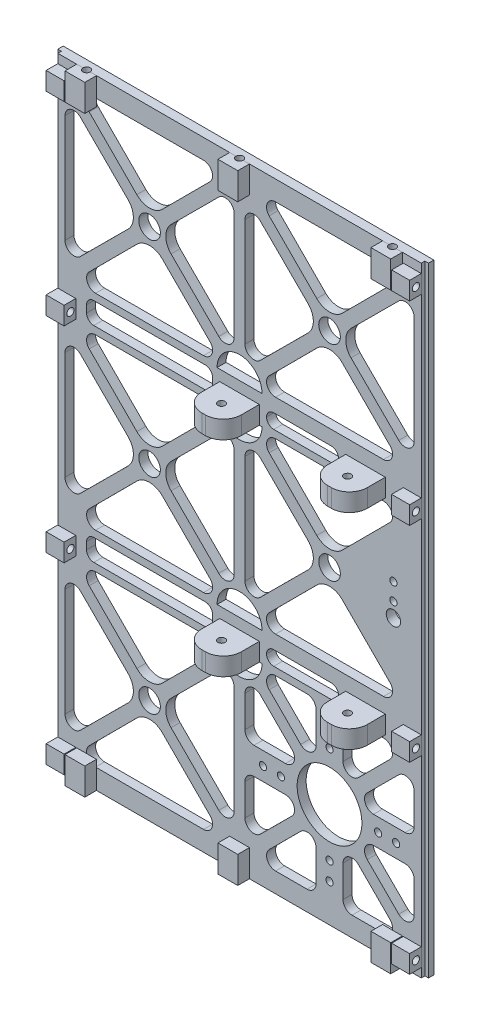
from build123d import *

# Parameters (mm, degrees)
SKICA1_W                  = 206
SKICA1_H                  = 344
P_IDAT_VYSUNUT_M1_DEPTH   = 5
SKICA3_R                  = 6
ODEBRAT_VYSUNUT_M2_DEPTH  = 10
SKICA21_W                 = 2
SKICA21_H                 = 2
ODEBRAT_VYSUNUT_M11_DEPTH = 360.123934039
SKICA16_W                 = 6.5
SKICA16_H                 = 10
P_IDAT_VYSUNUT_M5_DEPTH   = 10
P_IDAT_VYSUNUT_M5_2_DEPTH = 10
P_IDAT_VYSUNUT_M5_3_DEPTH = 10
P_IDAT_VYSUNUT_M5_4_DEPTH = 10
LINPOLE2_COUNT            = 2
LINPOLE2_PITCH            = 192
P_IDAT_VYSUNUT_M2_DEPTH   = 20
SKICA19_R                 = 2
ODEBRAT_VYSUNUT_M10_DEPTH = 269.001865665
P_IDAT_VYSUNUT_M3_DEPTH   = 5
SKICA9_R                  = 4
SKICA9_R_2                = 2
ODEBRAT_VYSUNUT_M6_DEPTH  = 203.034650493
SKICA11_R                 = 3
ODEBRAT_VYSUNUT_M7_DEPTH  = 2
LINPOLE3_COUNT            = 2
LINPOLE3_PITCH            = 114
SKICA12_W                 = 38
SKICA12_H                 = 15
SKICA12_R                 = 2
SKICA12_W_2               = 15
SKICA12_H_2               = 38
P_IDAT_VYSUNUT_M4_DEPTH   = 5
SKICA6_R                  = 2
SKICA6_R_2                = 6
ODEBRAT_VYSUNUT_M8_DEPTH  = 255.155464234
ZAOBLIT1_R                = 5
SKICA22_R                 = 2
ODEBRAT_VYSUNUT_M12_DEPTH = 269.001865665
P_IDAT_VYSUNUT_M9_DEPTH   = 6.5
P_IDAT_VYSUNUT_M9_2_DEPTH = 6.5
P_IDAT_VYSUNUT_M9_3_DEPTH = 6.5
SKICA24_R                 = 2
ODEBRAT_VYSUNUT_M13_DEPTH = 12
SKICA25_W                 = 48
SKICA25_H                 = 20
SKICA25_W_2               = 10
ODEBRAT_VYSUNUT_M14_DEPTH = 130
LINPOLE4_COUNT            = 2
LINPOLE4_PITCH            = 329
ZAOBLIT2_R                = 10
SKICA26_R                 = 18
SKICA26_W                 = 70
SKICA26_H                 = 12
SKICA26_W_2               = 40
SKICA26_H_2               = 8
ODEBRAT_VYSUNUT_M15_DEPTH = 202.477045839
ZAOBLIT3_R                = 4
SKICA28_R                 = 2
ODEBRAT_VYSUNUT_M16_DEPTH = 10
LINPOLE5_COUNT            = 2
LINPOLE5_PITCH            = 192


with BuildPart() as part:
    # Skica1 → Přidat vysunutím1 (new body)
    with BuildSketch(Plane.XY):
        Rectangle(SKICA1_W, SKICA1_H)
    extrude(amount=P_IDAT_VYSUNUT_M1_DEPTH)

    # Skica3 → Odebrat vysunutím2 (cut)
    with BuildSketch(Plane.XY.offset(5)):
        with Locations((50, 0)):
            Circle(SKICA3_R)
        with Locations((50, -114)):
            Circle(SKICA3_R)
        with Locations((50, 114)):
            Circle(SKICA3_R)
        with Locations((-50, -114)):
            Circle(SKICA3_R)
        with Locations((-50, 0)):
            Circle(SKICA3_R)
        with Locations((-50, 114)):
            Circle(SKICA3_R)
        with BuildLine():
            Line((11.530789502, 33.540271952), (38.061579004, 7.080543903))
            ThreePointArc((38.061579004, 7.080543903), (41, 0), (38.061579004, -7.080543903))
            Line((38.061579004, -7.080543903), (11.530789502, -33.540271952))
            ThreePointArc((11.530789502, -33.540271952), (6.083485913, -34.618113658), (3, -30))
            Line((3, -30), (3, 30))
            ThreePointArc((3, 30), (6.083485913, 34.618113658), (11.530789502, 33.540271952))
        make_face()
        with BuildLine():
            Line((83.540271952, 38.469210498), (57.080543903, 11.938420996))
            ThreePointArc((57.080543903, 11.938420996), (50, 9), (42.919456097, 11.938420996))
            Line((42.919456097, 11.938420996), (16.459728048, 38.469210498))
            ThreePointArc((16.459728048, 38.469210498), (15.381886342, 43.916514087), (20, 47))
            Line((20, 47), (80, 47))
            ThreePointArc((80, 47), (84.618113658, 43.916514087), (83.540271952, 38.469210498))
        make_face()
        with BuildLine():
            Line((16.459728048, -38.469210498), (42.919456097, -11.938420996))
            ThreePointArc((42.919456097, -11.938420996), (50, -9), (57.080543903, -11.938420996))
            Line((57.080543903, -11.938420996), (83.540271952, -38.469210498))
            ThreePointArc((83.540271952, -38.469210498), (84.618113658, -43.916514087), (80, -47))
            Line((80, -47), (20, -47))
            ThreePointArc((20, -47), (15.381886342, -43.916514087), (16.459728048, -38.469210498))
        make_face()
        with BuildLine():
            Line((97, 30), (97, -30))
            ThreePointArc((97, -30), (93.916514087, -34.618113658), (88.469210498, -33.540271952))
            Line((88.469210498, -33.540271952), (61.938420996, -7.080543903))
            ThreePointArc((61.938420996, -7.080543903), (59, 0), (61.938420996, 7.080543903))
            Line((61.938420996, 7.080543903), (88.469210498, 33.540271952))
            ThreePointArc((88.469210498, 33.540271952), (93.916514087, 34.618113658), (97, 30))
        make_face()
        with BuildLine():
            Line((16.459728048, -152.469210498), (42.919456097, -125.938420996))
            ThreePointArc((42.919456097, -125.938420996), (50, -123), (57.080543903, -125.938420996))
            Line((57.080543903, -125.938420996), (83.540271952, -152.469210498))
            ThreePointArc((83.540271952, -152.469210498), (84.618113658, -157.916514087), (80, -161))
            Line((80, -161), (20, -161))
            ThreePointArc((20, -161), (15.381886342, -157.916514087), (16.459728048, -152.469210498))
        make_face()
        with BuildLine():
            Line((88.469210498, -147.540271952), (61.938420996, -121.080543903))
            ThreePointArc((61.938420996, -121.080543903), (59, -114), (61.938420996, -106.919456097))
            Line((61.938420996, -106.919456097), (88.469210498, -80.459728048))
            ThreePointArc((88.469210498, -80.459728048), (93.916514087, -79.381886342), (97, -84))
            Line((97, -84), (97, -144))
            ThreePointArc((97, -144), (93.916514087, -148.618113658), (88.469210498, -147.540271952))
        make_face()
        with BuildLine():
            Line((20, -67), (80, -67))
            ThreePointArc((80, -67), (84.618113658, -70.083485913), (83.540271952, -75.530789502))
            Line((83.540271952, -75.530789502), (57.080543903, -102.061579004))
            ThreePointArc((57.080543903, -102.061579004), (50, -105), (42.919456097, -102.061579004))
            Line((42.919456097, -102.061579004), (16.459728048, -75.530789502))
            ThreePointArc((16.459728048, -75.530789502), (15.381886342, -70.083485913), (20, -67))
        make_face()
        with BuildLine():
            Line((3, -144), (3, -84))
            ThreePointArc((3, -84), (6.083485913, -79.381886342), (11.530789502, -80.459728048))
            Line((11.530789502, -80.459728048), (38.061579004, -106.919456097))
            ThreePointArc((38.061579004, -106.919456097), (41, -114), (38.061579004, -121.080543903))
            Line((38.061579004, -121.080543903), (11.530789502, -147.540271952))
            ThreePointArc((11.530789502, -147.540271952), (6.083485913, -148.618113658), (3, -144))
        make_face()
        with BuildLine():
            Line((20, 161), (80, 161))
            ThreePointArc((80, 161), (84.618113658, 157.916514087), (83.540271952, 152.469210498))
            Line((83.540271952, 152.469210498), (57.080543903, 125.938420996))
            ThreePointArc((57.080543903, 125.938420996), (50, 123), (42.919456097, 125.938420996))
            Line((42.919456097, 125.938420996), (16.459728048, 152.469210498))
            ThreePointArc((16.459728048, 152.469210498), (15.381886342, 157.916514087), (20, 161))
        make_face()
        with BuildLine():
            Line((3, 84), (3, 144))
            ThreePointArc((3, 144), (6.083485913, 148.618113658), (11.530789502, 147.540271952))
            Line((11.530789502, 147.540271952), (38.061579004, 121.080543903))
            ThreePointArc((38.061579004, 121.080543903), (41, 114), (38.061579004, 106.919456097))
            Line((38.061579004, 106.919456097), (11.530789502, 80.459728048))
            ThreePointArc((11.530789502, 80.459728048), (6.083485913, 79.381886342), (3, 84))
        make_face()
        with BuildLine():
            Line((16.459728048, 75.530789502), (42.919456097, 102.061579004))
            ThreePointArc((42.919456097, 102.061579004), (50, 105), (57.080543903, 102.061579004))
            Line((57.080543903, 102.061579004), (83.540271952, 75.530789502))
            ThreePointArc((83.540271952, 75.530789502), (84.618113658, 70.083485913), (80, 67))
            Line((80, 67), (20, 67))
            ThreePointArc((20, 67), (15.381886342, 70.083485913), (16.459728048, 75.530789502))
        make_face()
        with BuildLine():
            Line((88.469210498, 80.459728048), (61.938420996, 106.919456097))
            ThreePointArc((61.938420996, 106.919456097), (59, 114), (61.938420996, 121.080543903))
            Line((61.938420996, 121.080543903), (88.469210498, 147.540271952))
            ThreePointArc((88.469210498, 147.540271952), (93.916514087, 148.618113658), (97, 144))
            Line((97, 144), (97, 84))
            ThreePointArc((97, 84), (93.916514087, 79.381886342), (88.469210498, 80.459728048))
        make_face()
        with BuildLine():
            Line((-20, -161), (-80, -161))
            ThreePointArc((-80, -161), (-84.618113658, -157.916514087), (-83.540271952, -152.469210498))
            Line((-83.540271952, -152.469210498), (-57.080543903, -125.938420996))
            ThreePointArc((-57.080543903, -125.938420996), (-50, -123), (-42.919456097, -125.938420996))
            Line((-42.919456097, -125.938420996), (-16.459728048, -152.469210498))
            ThreePointArc((-16.459728048, -152.469210498), (-15.381886342, -157.916514087), (-20, -161))
        make_face()
        with BuildLine():
            Line((-97, -144), (-97, -84))
            ThreePointArc((-97, -84), (-93.916514087, -79.381886342), (-88.469210498, -80.459728048))
            Line((-88.469210498, -80.459728048), (-61.938420996, -106.919456097))
            ThreePointArc((-61.938420996, -106.919456097), (-59, -114), (-61.938420996, -121.080543903))
            Line((-61.938420996, -121.080543903), (-88.469210498, -147.540271952))
            ThreePointArc((-88.469210498, -147.540271952), (-93.916514087, -148.618113658), (-97, -144))
        make_face()
        with BuildLine():
            Line((-16.459728048, -75.530789502), (-42.919456097, -102.061579004))
            ThreePointArc((-42.919456097, -102.061579004), (-50, -105), (-57.080543903, -102.061579004))
            Line((-57.080543903, -102.061579004), (-83.540271952, -75.530789502))
            ThreePointArc((-83.540271952, -75.530789502), (-84.618113658, -70.083485913), (-80, -67))
            Line((-80, -67), (-20, -67))
            ThreePointArc((-20, -67), (-15.381886342, -70.083485913), (-16.459728048, -75.530789502))
        make_face()
        with BuildLine():
            Line((-11.530789502, -147.540271952), (-38.061579004, -121.080543903))
            ThreePointArc((-38.061579004, -121.080543903), (-41, -114), (-38.061579004, -106.919456097))
            Line((-38.061579004, -106.919456097), (-11.530789502, -80.459728048))
            ThreePointArc((-11.530789502, -80.459728048), (-6.083485913, -79.381886342), (-3, -84))
            Line((-3, -84), (-3, -144))
            ThreePointArc((-3, -144), (-6.083485913, -148.618113658), (-11.530789502, -147.540271952))
        make_face()
        with BuildLine():
            Line((-20, -47), (-80, -47))
            ThreePointArc((-80, -47), (-84.618113658, -43.916514087), (-83.540271952, -38.469210498))
            Line((-83.540271952, -38.469210498), (-57.080543903, -11.938420996))
            ThreePointArc((-57.080543903, -11.938420996), (-50, -9), (-42.919456097, -11.938420996))
            Line((-42.919456097, -11.938420996), (-16.459728048, -38.469210498))
            ThreePointArc((-16.459728048, -38.469210498), (-15.381886342, -43.916514087), (-20, -47))
        make_face()
        with BuildLine():
            Line((-88.469210498, 33.540271952), (-61.938420996, 7.080543903))
            ThreePointArc((-61.938420996, 7.080543903), (-59, 0), (-61.938420996, -7.080543903))
            Line((-61.938420996, -7.080543903), (-88.469210498, -33.540271952))
            ThreePointArc((-88.469210498, -33.540271952), (-93.916514087, -34.618113658), (-97, -30))
            Line((-97, -30), (-97, 30))
            ThreePointArc((-97, 30), (-93.916514087, 34.618113658), (-88.469210498, 33.540271952))
        make_face()
        with BuildLine():
            Line((-3, 30), (-3, -30))
            ThreePointArc((-3, -30), (-6.083485913, -34.618113658), (-11.530789502, -33.540271952))
            Line((-11.530789502, -33.540271952), (-38.061579004, -7.080543903))
            ThreePointArc((-38.061579004, -7.080543903), (-41, 0), (-38.061579004, 7.080543903))
            Line((-38.061579004, 7.080543903), (-11.530789502, 33.540271952))
            ThreePointArc((-11.530789502, 33.540271952), (-6.083485913, 34.618113658), (-3, 30))
        make_face()
        with BuildLine():
            Line((-16.459728048, 38.469210498), (-42.919456097, 11.938420996))
            ThreePointArc((-42.919456097, 11.938420996), (-50, 9), (-57.080543903, 11.938420996))
            Line((-57.080543903, 11.938420996), (-83.540271952, 38.469210498))
            ThreePointArc((-83.540271952, 38.469210498), (-84.618113658, 43.916514087), (-80, 47))
            Line((-80, 47), (-20, 47))
            ThreePointArc((-20, 47), (-15.381886342, 43.916514087), (-16.459728048, 38.469210498))
        make_face()
        with BuildLine():
            Line((-20, 67), (-80, 67))
            ThreePointArc((-80, 67), (-84.618113658, 70.083485913), (-83.540271952, 75.530789502))
            Line((-83.540271952, 75.530789502), (-57.080543903, 102.061579004))
            ThreePointArc((-57.080543903, 102.061579004), (-50, 105), (-42.919456097, 102.061579004))
            Line((-42.919456097, 102.061579004), (-16.459728048, 75.530789502))
            ThreePointArc((-16.459728048, 75.530789502), (-15.381886342, 70.083485913), (-20, 67))
        make_face()
        with BuildLine():
            Line((-97, 84), (-97, 144))
            ThreePointArc((-97, 144), (-93.916514087, 148.618113658), (-88.469210498, 147.540271952))
            Line((-88.469210498, 147.540271952), (-61.938420996, 121.080543903))
            ThreePointArc((-61.938420996, 121.080543903), (-59, 114), (-61.938420996, 106.919456097))
            Line((-61.938420996, 106.919456097), (-88.469210498, 80.459728048))
            ThreePointArc((-88.469210498, 80.459728048), (-93.916514087, 79.381886342), (-97, 84))
        make_face()
        with BuildLine():
            Line((-16.459728048, 152.469210498), (-42.919456097, 125.938420996))
            ThreePointArc((-42.919456097, 125.938420996), (-50, 123), (-57.080543903, 125.938420996))
            Line((-57.080543903, 125.938420996), (-83.540271952, 152.469210498))
            ThreePointArc((-83.540271952, 152.469210498), (-84.618113658, 157.916514087), (-80, 161))
            Line((-80, 161), (-20, 161))
            ThreePointArc((-20, 161), (-15.381886342, 157.916514087), (-16.459728048, 152.469210498))
        make_face()
        with BuildLine():
            Line((-11.530789502, 80.459728048), (-38.061579004, 106.919456097))
            ThreePointArc((-38.061579004, 106.919456097), (-41, 114), (-38.061579004, 121.080543903))
            Line((-38.061579004, 121.080543903), (-11.530789502, 147.540271952))
            ThreePointArc((-11.530789502, 147.540271952), (-6.083485913, 148.618113658), (-3, 144))
            Line((-3, 144), (-3, 84))
            ThreePointArc((-3, 84), (-6.083485913, 79.381886342), (-11.530789502, 80.459728048))
        make_face()
    extrude(amount=-ODEBRAT_VYSUNUT_M2_DEPTH, mode=Mode.SUBTRACT)

    # Skica21 → Odebrat vysunutím11 (cut, through all)
    with BuildSketch(Plane(origin=(0, 172, 0), x_dir=(1, 0, 0), z_dir=(0, 1, 0))):
        with Locations((102, -4)):
            Rectangle(SKICA21_W, SKICA21_H)
        with Locations((-102, -4)):
            Rectangle(SKICA21_W, SKICA21_H)
    extrude(amount=-ODEBRAT_VYSUNUT_M11_DEPTH, mode=Mode.SUBTRACT)

    # Skica5 → Přidat vysunutím2 (add)
    with BuildSketch(Plane.XY.offset(5)):
        Polygon((0, 59), (91, 59), (91, 49), (0, 49), (-11, 49), (-11, 59), align=None)
    p_idat_vysunut_m2 = extrude(amount=P_IDAT_VYSUNUT_M2_DEPTH)

    # Skica8 → Přidat vysunutím3 (add)
    with BuildSketch(Plane.XY.offset(5)):
        with BuildLine():
            Line((61.938420996, -7.080543903), (88.469210498, -33.540271952))
            ThreePointArc((88.469210498, -33.540271952), (93.916514087, -34.618113658), (97, -30))
            Line((97, -30), (97, 30))
            ThreePointArc((97, 30), (93.916514087, 34.618113658), (88.469210498, 33.540271952))
            Line((88.469210498, 33.540271952), (61.938420996, 7.080543903))
            ThreePointArc((61.938420996, 7.080543903), (59, 0), (61.938420996, -7.080543903))
        make_face()
    extrude(amount=-P_IDAT_VYSUNUT_M3_DEPTH)

    # Skica9 → Odebrat vysunutím6 (cut, through all)
    with BuildSketch(Plane(origin=(0, 0, 0), x_dir=(-1, 0, 0), z_dir=(0, 0, -1))):
        with Locations((-85.5, -6.5)):
            Circle(SKICA9_R)
        with Locations((-85.5, 1.5)):
            Circle(SKICA9_R_2)
        with Locations((-85.5, 11)):
            Circle(SKICA9_R_2)
    extrude(amount=-ODEBRAT_VYSUNUT_M6_DEPTH, mode=Mode.SUBTRACT)

    # Skica11 → Odebrat vysunutím7 (cut)
    with BuildSketch(Plane(origin=(0, 0, 0), x_dir=(-1, 0, 0), z_dir=(0, 0, -1))):
        with Locations((-85.5, 11)):
            Circle(SKICA11_R)
        with Locations((-85.5, 1.5)):
            Circle(SKICA11_R)
    extrude(amount=-ODEBRAT_VYSUNUT_M7_DEPTH, mode=Mode.SUBTRACT)

    # LinPole3: Přidat vysunutím2 ×2
    with Locations(*[(0, -i * LINPOLE3_PITCH, 0) for i in range(1, LINPOLE3_COUNT)]):
        add(p_idat_vysunut_m2)

    # Skica12 → Přidat vysunutím4 (add)
    # profile 1 of 4: a face of its own
    with BuildSketch(Plane.XY.offset(5)):
        with Locations((78, -114)):
            Rectangle(SKICA12_W, SKICA12_H)
        with Locations((87, -114)):
            Circle(SKICA12_R, mode=Mode.SUBTRACT)
        with Locations(Location((77, -114, 0), (0, 0, 180))):
            Circle(SKICA12_R, mode=Mode.SUBTRACT)
    # profile 2 of 4: a face of its own
    with BuildSketch(Plane.XY.offset(5)):
        with Locations((22, -114)):
            Rectangle(SKICA12_W, SKICA12_H)
        with Locations(Location((13, -114, 0), (0, 0, 180))):
            Circle(SKICA12_R, mode=Mode.SUBTRACT)
        with Locations((23, -114)):
            Circle(SKICA12_R, mode=Mode.SUBTRACT)
    # profile 3 of 4: a face of its own
    with BuildSketch(Plane.XY.offset(5)):
        with Locations((50, -142)):
            Rectangle(SKICA12_W_2, SKICA12_H_2)
        with Locations((50, -141)):
            Circle(SKICA12_R, mode=Mode.SUBTRACT)
        with Locations(Location((50, -151, 0), (0, 0, 180))):
            Circle(SKICA12_R, mode=Mode.SUBTRACT)
    # profile 4 of 4: a face of its own
    with BuildSketch(Plane.XY.offset(5)):
        with Locations((50, -86)):
            Rectangle(SKICA12_W_2, SKICA12_H_2)
        with Locations(Location((50, -87, 0), (0, 0, 180))):
            Circle(SKICA12_R, mode=Mode.SUBTRACT)
        with Locations((50, -77)):
            Circle(SKICA12_R, mode=Mode.SUBTRACT)
    extrude(amount=-P_IDAT_VYSUNUT_M4_DEPTH)

    # Skica6 → Odebrat vysunutím8 (cut, through all)
    with BuildSketch(Plane(origin=(0, 59, 0), x_dir=(1, 0, 0), z_dir=(0, 1, 0))):
        with Locations(Location((70, -15, 0), (0, 0, 270))):
            Circle(SKICA6_R)
        with Locations(Location((0, -15, 0), (0, 0, 270))):
            Circle(SKICA6_R)
        with Locations(Location((45, -15, 0), (0, 0, 270))):
            Circle(SKICA6_R_2)
    extrude(amount=-ODEBRAT_VYSUNUT_M8_DEPTH, mode=Mode.SUBTRACT)

    # Zaoblit1
    zaoblit1_edges = [part.edges().sort_by_distance(p)[0] for p in [
        (97, -121.5, 2.5),
        (62.359003603, -121.5, 2.5),
        (62.359003603, -106.5, 2.5),
        (97, -106.5, 2.5),
        (37.640996397, -121.5, 2.5),
        (37.640996397, -106.5, 2.5),
        (3, -106.5, 2.5),
        (3, -121.5, 2.5),
        (42.5, -161, 2.5),
        (57.5, -126.359003603, 2.5),
        (57.5, -161, 2.5),
        (42.5, -126.359003603, 2.5),
        (42.5, -101.640996397, 2.5),
        (57.5, -101.640996397, 2.5),
        (57.5, -67, 2.5),
        (42.5, -67, 2.5),
    ]]
    fillet(zaoblit1_edges, radius=ZAOBLIT1_R)


with BuildPart() as body_2:
    # Skica16 → Přidat vysunutím5 (new body)
    with BuildSketch(Plane(origin=(101, 0, 0), x_dir=(0, 0, -1), z_dir=(1, 0, 0))):
        with Locations((-8.25, -60)):
            Rectangle(SKICA16_W, SKICA16_H)
    p_idat_vysunut_m5 = extrude(amount=-P_IDAT_VYSUNUT_M5_DEPTH)

    # Skica28 → Odebrat vysunutím16 (cut)
    with BuildSketch(Plane(origin=(101, 0, 0), x_dir=(0, 0, -1), z_dir=(1, 0, 0))):
        with Locations((-8, -60)):
            Circle(SKICA28_R)
    odebrat_vysunut_m16 = extrude(amount=-ODEBRAT_VYSUNUT_M16_DEPTH, mode=Mode.SUBTRACT)


with BuildPart() as body_3:
    # Skica16 → P_idat vysunut_m5 2 (new body)
    with BuildSketch(Plane(origin=(101, 0, 0), x_dir=(0, 0, -1), z_dir=(1, 0, 0))):
        with Locations((-8.25, 162)):
            Rectangle(SKICA16_W, SKICA16_H)
    p_idat_vysunut_m5_2 = extrude(amount=-P_IDAT_VYSUNUT_M5_2_DEPTH)


with BuildPart() as body_4:
    # Skica16 → P_idat vysunut_m5 3 (new body)
    with BuildSketch(Plane(origin=(101, 0, 0), x_dir=(0, 0, -1), z_dir=(1, 0, 0))):
        with Locations((-8.25, 54)):
            Rectangle(SKICA16_W, SKICA16_H)
    p_idat_vysunut_m5_3 = extrude(amount=-P_IDAT_VYSUNUT_M5_3_DEPTH)


with BuildPart() as body_5:
    # Skica16 → P_idat vysunut_m5 4 (new body)
    with BuildSketch(Plane(origin=(101, 0, 0), x_dir=(0, 0, -1), z_dir=(1, 0, 0))):
        with Locations((-8.25, -162)):
            Rectangle(SKICA16_W, SKICA16_H)
    p_idat_vysunut_m5_4 = extrude(amount=-P_IDAT_VYSUNUT_M5_4_DEPTH)


with BuildPart() as linpole2_1:
    # LinPole2: pattern copy
    add(p_idat_vysunut_m5.moved(Location(Vector(-1, 0, 0) * (1 * LINPOLE2_PITCH))))

    # LinPole5: Odebrat vysunutím16 ×2
    with Locations(*[(-i * LINPOLE5_PITCH, 0, 0) for i in range(1, LINPOLE5_COUNT)]):
        add(odebrat_vysunut_m16, mode=Mode.SUBTRACT)


with BuildPart() as linpole2_2:
    # LinPole2: pattern copy
    add(p_idat_vysunut_m5_2.moved(Location(Vector(-1, 0, 0) * (1 * LINPOLE2_PITCH))))


with BuildPart() as linpole2_3:
    # LinPole2: pattern copy
    add(p_idat_vysunut_m5_3.moved(Location(Vector(-1, 0, 0) * (1 * LINPOLE2_PITCH))))


with BuildPart() as linpole2_4:
    # LinPole2: pattern copy
    add(p_idat_vysunut_m5_4.moved(Location(Vector(-1, 0, 0) * (1 * LINPOLE2_PITCH))))


with BuildPart() as odebrat_vysunut_m10_tool:
    # Skica19 → Odebrat vysunutím10 (new, through all)
    with BuildSketch(Plane(origin=(101, 0, 0), x_dir=(0, 0, -1), z_dir=(1, 0, 0))):
        with Locations((-8, 162)):
            Circle(SKICA19_R)
        with Locations((-8, 54)):
            Circle(SKICA19_R)
    extrude(amount=-ODEBRAT_VYSUNUT_M10_DEPTH)


with BuildPart() as body_3_1:
    add(body_3.part)

    # Odebrat vysunutím10: cut by odebrat_vysunut_m10_tool
    add(odebrat_vysunut_m10_tool.part, mode=Mode.SUBTRACT)


with BuildPart() as body_4_1:
    add(body_4.part)

    # Odebrat vysunutím10: cut by odebrat_vysunut_m10_tool
    add(odebrat_vysunut_m10_tool.part, mode=Mode.SUBTRACT)


with BuildPart() as linpole2_2_1:
    add(linpole2_2.part)

    # Odebrat vysunutím10: cut by odebrat_vysunut_m10_tool
    add(odebrat_vysunut_m10_tool.part, mode=Mode.SUBTRACT)


with BuildPart() as linpole2_3_1:
    add(linpole2_3.part)

    # Odebrat vysunutím10: cut by odebrat_vysunut_m10_tool
    add(odebrat_vysunut_m10_tool.part, mode=Mode.SUBTRACT)


with BuildPart() as odebrat_vysunut_m12_tool:
    # Skica22 → Odebrat vysunutím12 (new, through all)
    with BuildSketch(Plane(origin=(101, 0, 0), x_dir=(0, 0, -1), z_dir=(1, 0, 0))):
        with Locations((-8, -162)):
            Circle(SKICA22_R)
    extrude(amount=-ODEBRAT_VYSUNUT_M12_DEPTH)


with BuildPart() as body_5_1:
    add(body_5.part)

    # Odebrat vysunutím12: cut by odebrat_vysunut_m12_tool
    add(odebrat_vysunut_m12_tool.part, mode=Mode.SUBTRACT)


with BuildPart() as linpole2_4_1:
    add(linpole2_4.part)

    # Odebrat vysunutím12: cut by odebrat_vysunut_m12_tool
    add(odebrat_vysunut_m12_tool.part, mode=Mode.SUBTRACT)


with BuildPart() as body_10:
    # Skica23 → Přidat vysunutím9 (new body)
    with BuildSketch(Plane.XY.offset(5)):
        Polygon((85, 172), (90.5, 172), (90.5, 157), (79.5, 157), (79.5, 172), align=None)
    p_idat_vysunut_m9 = extrude(amount=P_IDAT_VYSUNUT_M9_DEPTH)


with BuildPart() as body_11:
    # Skica23 → P_idat vysunut_m9 2 (new body)
    with BuildSketch(Plane.XY.offset(5)):
        Polygon((0, 172), (-5.5, 172), (-5.5, 157), (5.5, 157), (5.5, 172), align=None)
    p_idat_vysunut_m9_2 = extrude(amount=P_IDAT_VYSUNUT_M9_2_DEPTH)


with BuildPart() as body_12:
    # Skica23 → P_idat vysunut_m9 3 (new body)
    with BuildSketch(Plane.XY.offset(5)):
        Polygon((-85, 172), (-90.5, 172), (-90.5, 157), (-79.5, 157), (-79.5, 172), align=None)
    p_idat_vysunut_m9_3 = extrude(amount=P_IDAT_VYSUNUT_M9_3_DEPTH)


with BuildPart() as odebrat_vysunut_m13_tool:
    # Skica24 → Odebrat vysunutím13 (new body)
    with BuildSketch(Plane(origin=(0, 172, 0), x_dir=(1, 0, 0), z_dir=(0, 1, 0))):
        with Locations((-85, -5)):
            Circle(SKICA24_R)
        with Locations((0, -5)):
            Circle(SKICA24_R)
        with Locations((85, -5)):
            Circle(SKICA24_R)
    odebrat_vysunut_m13 = extrude(amount=-ODEBRAT_VYSUNUT_M13_DEPTH)


with BuildPart() as part_1:
    add(part.part)

    # Odebrat vysunutím13: cut by odebrat_vysunut_m13_tool
    add(odebrat_vysunut_m13_tool.part, mode=Mode.SUBTRACT)

    # Skica25 → Odebrat vysunutím14 (cut)
    with BuildSketch(Plane(origin=(0, 59, 0), x_dir=(1, 0, 0), z_dir=(0, 1, 0))):
        with Locations((35, -15)):
            Rectangle(SKICA25_W, SKICA25_H)
        with Locations((86, -15)):
            Rectangle(SKICA25_W_2, SKICA25_H)
    extrude(amount=-ODEBRAT_VYSUNUT_M14_DEPTH, mode=Mode.SUBTRACT)


with BuildPart() as body_10_1:
    add(body_10.part)

    # Odebrat vysunutím13: cut by odebrat_vysunut_m13_tool
    add(odebrat_vysunut_m13_tool.part, mode=Mode.SUBTRACT)


with BuildPart() as body_11_1:
    add(body_11.part)

    # Odebrat vysunutím13: cut by odebrat_vysunut_m13_tool
    add(odebrat_vysunut_m13_tool.part, mode=Mode.SUBTRACT)


with BuildPart() as body_12_1:
    add(body_12.part)

    # Odebrat vysunutím13: cut by odebrat_vysunut_m13_tool
    add(odebrat_vysunut_m13_tool.part, mode=Mode.SUBTRACT)


with BuildPart() as linpole4_1:
    # LinPole4: pattern copy
    add(p_idat_vysunut_m9.moved(Location(Vector(0, -1, 0) * (1 * LINPOLE4_PITCH))))


with BuildPart() as linpole4_2:
    # LinPole4: pattern copy
    add(p_idat_vysunut_m9_2.moved(Location(Vector(0, -1, 0) * (1 * LINPOLE4_PITCH))))


with BuildPart() as linpole4_3:
    # LinPole4: pattern copy
    add(p_idat_vysunut_m9_3.moved(Location(Vector(0, -1, 0) * (1 * LINPOLE4_PITCH))))


with BuildPart() as zrcadlit4_tool:
    # Zrcadlit4: Odebrat vysunutím13 across plane
    add(odebrat_vysunut_m13.mirror(Plane.ZX))


with BuildPart() as part_2:
    add(part_1.part)

    # Zrcadlit4: cut by zrcadlit4_tool
    add(zrcadlit4_tool.part, mode=Mode.SUBTRACT)

    # Zaoblit2
    zaoblit2_edges = [part_2.edges().sort_by_distance(p)[0] for p in [
        (81, -60, 25),
        (11, -60, 25),
        (59, -60, 25),
        (59, 54, 25),
        (11, 54, 25),
        (81, 54, 25),
        (-11, 54, 25),
        (-11, -60, 25),
    ]]
    fillet(zaoblit2_edges, radius=ZAOBLIT2_R)

    # Skica26 → Odebrat vysunutím15 (cut, through all)
    with BuildSketch(Plane.XY.offset(5)):
        with Locations((50, -114)):
            Circle(SKICA26_R)
        with Locations((-50, -57)):
            Rectangle(SKICA26_W, SKICA26_H)
        with Locations((-50, 57)):
            Rectangle(SKICA26_W, SKICA26_H)
        with BuildLine():
            Line((12.5, 65), (-12.5, 65))
            ThreePointArc((-12.5, 65), (0, 77.5), (12.5, 65))
        make_face()
        with BuildLine():
            Line((12.5, 49), (-12.5, 49))
            ThreePointArc((-12.5, 49), (0, 36.5), (12.5, 49))
        make_face()
        with BuildLine():
            Line((12.5, -65), (-12.5, -65))
            ThreePointArc((-12.5, -65), (0, -77.5), (12.5, -65))
        make_face()
        with BuildLine():
            Line((12.5, -49), (-12.5, -49))
            ThreePointArc((-12.5, -49), (0, -36.5), (12.5, -49))
        make_face()
        with Locations((35, -59)):
            Rectangle(SKICA26_W_2, SKICA26_H_2)
        with Locations((35, 55)):
            Rectangle(SKICA26_W_2, SKICA26_H_2)
    extrude(amount=-ODEBRAT_VYSUNUT_M15_DEPTH, mode=Mode.SUBTRACT)

    # Zaoblit3
    zaoblit3_edges = [part_2.edges().sort_by_distance(p)[0] for p in [
        (-15, 51, 2.5),
        (-15, 63, 2.5),
        (-85, 63, 2.5),
        (-85, 51, 2.5),
        (-85, -63, 2.5),
        (-85, -51, 2.5),
        (-15, -63, 2.5),
        (-15, -51, 2.5),
        (55, 59, 2.5),
        (55, 51, 2.5),
        (15, 59, 2.5),
        (15, 51, 2.5),
        (55, -55, 2.5),
        (55, -63, 2.5),
        (15, -55, 2.5),
        (15, -63, 2.5),
    ]]
    fillet(zaoblit3_edges, radius=ZAOBLIT3_R - 0.0001)  # a hair under: the kernel refuses the full size


with BuildPart() as linpole4_1_1:
    add(linpole4_1.part)

    # Zrcadlit4: cut by zrcadlit4_tool
    add(zrcadlit4_tool.part, mode=Mode.SUBTRACT)


with BuildPart() as linpole4_2_1:
    add(linpole4_2.part)

    # Zrcadlit4: cut by zrcadlit4_tool
    add(zrcadlit4_tool.part, mode=Mode.SUBTRACT)


with BuildPart() as linpole4_3_1:
    add(linpole4_3.part)

    # Zrcadlit4: cut by zrcadlit4_tool
    add(zrcadlit4_tool.part, mode=Mode.SUBTRACT)


solid = Compound([body_2.part, linpole2_1.part, body_3_1.part, body_4_1.part, linpole2_2_1.part, linpole2_3_1.part, body_5_1.part, linpole2_4_1.part, body_10_1.part, body_11_1.part, body_12_1.part, part_2.part, linpole4_1_1.part, linpole4_2_1.part, linpole4_3_1.part])
